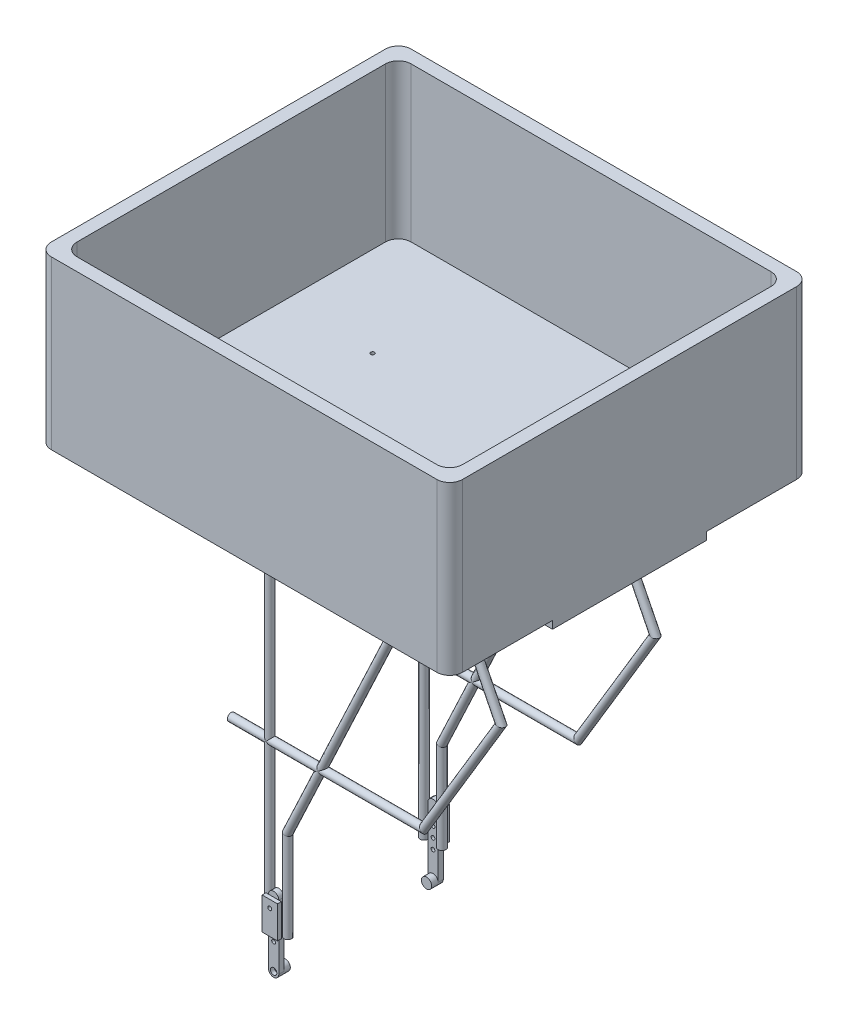
from build123d import *
from build123d.topology import SkipClean

# Parameters (mm, degrees)
SKETCH1_W            = 406.4
SKETCH1_H            = 355.6
BOSS_EXTRUDE1_DEPTH  = 165.1
FILLET1_R            = 12.7
FILLET2_R            = 12.7
FILLET3_R            = 12.7
FILLET4_R            = 12.7
SHELL1_START         = 12.7
SHELL1_OUTLINE_W     = 152.4
SHELL1_OUTLINE_H     = 330.2
SHELL1_DEPTH         = 381
FILLET5_R            = 12.7
FILLET6_R            = 12.7
FILLET7_R            = 12.7
FILLET8_R            = 12.7
SKETCH2_W            = 406.4
SKETCH2_H            = 152.4
BOSS_EXTRUDE2_DEPTH  = 7.62
BOSS_EXTRUDE3_START  = -60.96
BOSS_EXTRUDE3_DEPTH  = 3.81
BOSS_EXTRUDE4_START  = -57.15
BOSS_EXTRUDE4_DEPTH  = 3.81
SWEEP1_PROFILE_R     = 3.81
SWEEP2_PROFILE_R     = 3.81
SWEEP3_PROFILE_R     = 3.81
SWEEP4_PROFILE_R     = 3.81
SWEEP5_PROFILE_R     = 3.81
SWEEP6_PROFILE_R     = 3.81
BOSS_EXTRUDE5_DEPTH  = 5.08
BOSS_EXTRUDE6_DEPTH  = 5.08
SKETCH67_R           = 5.08
BOSS_EXTRUDE9_DEPTH  = 6.35
SKETCH68_R           = 5.08
BOSS_EXTRUDE10_DEPTH = 6.35
SKETCH69_R           = 3.175
CUT_EXTRUDE1_DEPTH   = 3.81
SKETCH70_R           = 3.175
CUT_EXTRUDE2_DEPTH   = 3.81
SKETCH71_R           = 1.905
CUT_EXTRUDE3_DEPTH   = 652.351540184
SKETCH64_W           = 15.24
SKETCH64_H           = 31.75
BOSS_EXTRUDE11_DEPTH = 3.81
SKETCH65_W           = 15.24
SKETCH65_H           = 31.75
BOSS_EXTRUDE12_DEPTH = 3.81
CUT_EXTRUDE4_START   = -33.02
SKETCH72_R           = 1.905
CUT_EXTRUDE4_DEPTH   = 685.371540184
SKETCH73_R           = 1.905
CUT_EXTRUDE5_DEPTH   = 630.194965809
CUT_EXTRUDE6_START   = 5.08
SKETCH74_R           = 1.905
CUT_EXTRUDE6_DEPTH   = 3.81
CUT_EXTRUDE7_START   = 1.27
SKETCH75_R           = 1.905
CUT_EXTRUDE7_DEPTH   = 3.81
SKETCH76_R           = 1.905
CUT_EXTRUDE8_DEPTH   = 691.628989328


# Read off the part's stored shape, not the designer's step: Shell1
with BuildPart() as part:
    # Sketch1 → Boss-Extrude1 (new body)
    with BuildSketch(Plane(origin=(0, 0, 0), x_dir=(1, 0, 0), z_dir=(0, 1, 0))):
        with Locations((203.2, -177.8)):
            Rectangle(SKETCH1_W, SKETCH1_H)
    extrude(amount=BOSS_EXTRUDE1_DEPTH)

    # Fillet1
    fillet1_edges = [part.edges().sort_by_distance(p)[0] for p in [
        (0, 82.55, 0),
    ]]
    fillet(fillet1_edges, radius=FILLET1_R)

    # Fillet2
    fillet2_edges = [part.edges().sort_by_distance(p)[0] for p in [
        (0, 82.55, 355.6),
    ]]
    fillet(fillet2_edges, radius=FILLET2_R)

    # Fillet3
    fillet3_edges = [part.edges().sort_by_distance(p)[0] for p in [
        (406.4, 82.55, 0),
    ]]
    fillet(fillet3_edges, radius=FILLET3_R)

    # Fillet4
    fillet4_edges = [part.edges().sort_by_distance(p)[0] for p in [
        (406.4, 82.55, 355.6),
    ]]
    fillet(fillet4_edges, radius=FILLET4_R)

    # Shell1 outline → Shell1 (cut)
    with BuildSketch(Plane.YZ.offset(SHELL1_START)):
        with Locations((88.9, 177.8)):
            Rectangle(SHELL1_OUTLINE_W, SHELL1_OUTLINE_H)
    extrude(amount=SHELL1_DEPTH, mode=Mode.SUBTRACT)

    # Fillet5
    fillet5_edges = [part.edges().sort_by_distance(p)[0] for p in [
        (12.7, 88.9, 12.7),
    ]]
    fillet(fillet5_edges, radius=FILLET5_R)

    # Fillet6
    fillet6_edges = [part.edges().sort_by_distance(p)[0] for p in [
        (12.7, 88.9, 342.9),
    ]]
    fillet(fillet6_edges, radius=FILLET6_R)

    # Fillet7
    fillet7_edges = [part.edges().sort_by_distance(p)[0] for p in [
        (393.7, 88.9, 12.7),
    ]]
    fillet(fillet7_edges, radius=FILLET7_R)

    # Fillet8
    fillet8_edges = [part.edges().sort_by_distance(p)[0] for p in [
        (393.7, 88.9, 342.9),
    ]]
    fillet(fillet8_edges, radius=FILLET8_R)

    # Sketch2 → Boss-Extrude2 (add)
    with BuildSketch(Plane.XZ):
        with Locations((203.2, 177.8)):
            Rectangle(SKETCH2_W, SKETCH2_H)
    extrude(amount=BOSS_EXTRUDE2_DEPTH)

    # Sketch3 → Boss-Extrude3 (add)
    with BuildSketch(Plane.XY.offset(254).offset(BOSS_EXTRUDE3_START)):
        with BuildLine():
            Line((27.692915238, -6.852801293), (-134.589820403, -129.141613998))
            ThreePointArc((-134.589820403, -129.141613998), (-139.925536935, -128.391727943), (-139.17565088, -123.056011411))
            Line((-139.17565088, -123.056011411), (23.107084762, -0.767198707))
            ThreePointArc((23.107084762, -0.767198707), (28.442801293, -1.517084762), (27.692915238, -6.852801293))
        make_face()
    extrude(amount=BOSS_EXTRUDE3_DEPTH)

    # Sketch4 → Boss-Extrude4 (add)
    with BuildSketch(Plane(origin=(0, 0, 101.6), x_dir=(-1, 0, 0), z_dir=(0, 0, -1)).offset(BOSS_EXTRUDE4_START)):
        with BuildLine():
            Line((134.589820403, -129.141613998), (-27.692915238, -6.852801293))
            ThreePointArc((-27.692915238, -6.852801293), (-28.442801293, -1.517084762), (-23.107084762, -0.767198707))
            Line((-23.107084762, -0.767198707), (139.17565088, -123.056011411))
            ThreePointArc((139.17565088, -123.056011411), (139.925536935, -128.391727943), (134.589820403, -129.141613998))
        make_face()
    extrude(amount=-BOSS_EXTRUDE4_DEPTH)

    # Sweep1: sweep along a path in Sketch5
    with BuildLine(Plane.XY.offset(254)) as sweep1_path:
        Line((127, 0), (127, -401.32))
    # Sweep1 profile (on start of the path) → Sweep1 (sweep)
    with BuildSketch(Plane(origin=(127, 0, 254), x_dir=(-1, 0, 0), z_dir=(0, -1, 0))):
        Circle(SWEEP1_PROFILE_R)
    sweep(path=sweep1_path.line)

    # Sweep2: sweep along a path in Sketch15
    with BuildLine(Plane.XY.offset(254)) as sweep2_path:
        Line((279.4, 0), (279.4, -25.4))
        Line((279.4, -25.4), (144.78, -312.42))
        Line((144.78, -312.42), (144.78, -401.32))
    # Sweep2 profile (on start of the path) → Sweep2 (sweep)
    with BuildSketch(Plane(origin=(279.4, 0, 254), x_dir=(-1, 0, 0), z_dir=(0, -1, 0))):
        Circle(SWEEP2_PROFILE_R)
    sweep(path=sweep2_path.line, transition=Transition.RIGHT)

    # Sweep3: sweep along a path in Sketch24
    with BuildLine(Plane(origin=(0, 0, 101.6), x_dir=(-1, 0, 0), z_dir=(0, 0, -1))) as sweep3_path:
        Line((-127, 0), (-127, -401.32))
    # Sweep3 profile (on start of the path) → Sweep3 (sweep)
    with BuildSketch(Plane(origin=(127, 0, 101.6), x_dir=(-1, 0, 0), z_dir=(0, -1, 0))):
        Circle(SWEEP3_PROFILE_R)
    sweep(path=sweep3_path.line)

    # Sweep4: sweep along a path in Sketch33
    with BuildLine(Plane(origin=(0, 0, 101.6), x_dir=(-1, 0, 0), z_dir=(0, 0, -1))) as sweep4_path:
        Line((-279.4, 0), (-279.4, -25.4))
        Line((-279.4, -25.4), (-144.78, -312.42))
        Line((-144.78, -312.42), (-144.78, -401.32))
    # Sweep4 profile (on start of the path) → Sweep4 (sweep)
    with BuildSketch(Plane(origin=(279.4, 0, 101.6), x_dir=(0, 0, -1), z_dir=(0, -1, 0))):
        Circle(SWEEP4_PROFILE_R)
    sweep(path=sweep4_path.line, transition=Transition.RIGHT)

    # Sweep5: sweep along a path in Sketch42
    with BuildLine(Plane(origin=(0, 0, 101.6), x_dir=(-1, 0, 0), z_dir=(0, 0, -1))) as sweep5_path:
        Line((-88.9, -38.1), (-317.5, -38.1))
        Line((-317.5, -38.1), (-355.6, -114.3))
        Line((-355.6, -114.3), (-279.4, -241.3))
        Line((-279.4, -241.3), (-88.9, -241.3))
    # Sweep5 profile (on start of the path) → Sweep5 (sweep)
    with BuildSketch(Plane(origin=(88.9, -38.1, 101.6), x_dir=(0, 1, 0), z_dir=(1, 0, 0))):
        Circle(SWEEP5_PROFILE_R)
    sweep(path=sweep5_path.line, transition=Transition.RIGHT)

    # Sweep6: sweep along a path in Sketch51
    with BuildLine(Plane.XY.offset(254)) as sweep6_path:
        Line((88.9, -38.1), (317.5, -38.1))
        Line((317.5, -38.1), (355.6, -114.3))
        Line((355.6, -114.3), (279.4, -241.3))
        Line((279.4, -241.3), (88.9, -241.3))
    # Sweep6 profile (on start of the path) → Sweep6 (sweep)
    with BuildSketch(Plane(origin=(88.9, -38.1, 254), x_dir=(0, 1, 0), z_dir=(1, 0, 0))):
        Circle(SWEEP6_PROFILE_R)
    sweep(path=sweep6_path.line, transition=Transition.RIGHT)

    # Sketch73 → Cut-Extrude5 (cut, through all)
    with BuildSketch(Plane.XY.offset(196.85)):
        with Locations(Location((-136.882735642, -126.098812704, 0), (0, 0, 180))):
            Circle(SKETCH73_R)
    extrude(amount=-CUT_EXTRUDE5_DEPTH, mode=Mode.SUBTRACT)

    # Sketch74 → Cut-Extrude6 (cut)
    with BuildSketch(Plane.XY.offset(254).offset(CUT_EXTRUDE6_START)):
        with Locations((127, -3.81)):
            Circle(SKETCH74_R)
        with Locations((279.4, -3.846627326)):
            Circle(SKETCH74_R)
    extrude(amount=-CUT_EXTRUDE6_DEPTH, mode=Mode.SUBTRACT)

    # Sketch75 → Cut-Extrude7 (cut)
    with BuildSketch(Plane(origin=(0, 0, 101.6), x_dir=(-1, 0, 0), z_dir=(0, 0, -1)).offset(CUT_EXTRUDE7_START)):
        with Locations(Location((-127, -3.81, 0), (0, 0, 180))):
            Circle(SKETCH75_R)
        with Locations((-279.4, -3.81)):
            Circle(SKETCH75_R)
    extrude(amount=CUT_EXTRUDE7_DEPTH, mode=Mode.SUBTRACT)

    # Sketch76 → Cut-Extrude8 (cut, through all)
    with BuildSketch(Plane.XZ.offset(7.62)):
        with Locations(Location((101.6, 228.6, 0), (0, 0, 270))):
            Circle(SKETCH76_R)
        with Locations(Location((101.6, 127, 0), (0, 0, 90))):
            Circle(SKETCH76_R)
        with Locations(Location((304.8, 228.6, 0), (0, 0, 90))):
            Circle(SKETCH76_R)
        with Locations(Location((304.8, 127, 0), (0, 0, 270))):
            Circle(SKETCH76_R)
    extrude(amount=-CUT_EXTRUDE8_DEPTH, mode=Mode.SUBTRACT)


with BuildPart() as body_2:
    # Sketch60 → Boss-Extrude5 (new body)
    with BuildSketch(Plane.XY.offset(254)):
        with BuildLine():
            Line((140.97, -369.57), (140.97, -433.07))
            ThreePointArc((140.97, -433.07), (135.89, -438.15), (130.81, -433.07))
            Line((130.81, -433.07), (130.81, -369.57))
            ThreePointArc((130.81, -369.57), (135.89, -364.49), (140.97, -369.57))
        make_face()
    extrude(amount=BOSS_EXTRUDE5_DEPTH)

    # Sketch67 → Boss-Extrude9 (add)
    with SkipClean():  # the faces are left unmerged after this step: merging them gives an invalid solid
        with BuildSketch(Plane(origin=(0, 0, 254), x_dir=(-1, 0, 0), z_dir=(0, 0, -1))):
            with Locations((-135.89, -433.07)):
                Circle(SKETCH67_R)
        extrude(amount=BOSS_EXTRUDE9_DEPTH)

    # Sketch69 → Cut-Extrude1 (cut)
    with SkipClean():  # the faces are left unmerged after this step: merging them gives an invalid solid
        with BuildSketch(Plane.XY.offset(259.08)):
            with Locations((135.89, -433.07)):
                Circle(SKETCH69_R)
        extrude(amount=-CUT_EXTRUDE1_DEPTH, mode=Mode.SUBTRACT)


with BuildPart() as body_3:
    # Sketch62 → Boss-Extrude6 (new body)
    with BuildSketch(Plane(origin=(0, 0, 101.6), x_dir=(-1, 0, 0), z_dir=(0, 0, -1))):
        with BuildLine():
            Line((-130.81, -369.57), (-130.81, -433.07))
            ThreePointArc((-130.81, -433.07), (-135.89, -438.15), (-140.97, -433.07))
            Line((-140.97, -433.07), (-140.97, -369.57))
            ThreePointArc((-140.97, -369.57), (-135.89, -364.49), (-130.81, -369.57))
        make_face()
    extrude(amount=BOSS_EXTRUDE6_DEPTH)

    # Sketch68 → Boss-Extrude10 (add)
    with SkipClean():  # the faces are left unmerged after this step: merging them gives an invalid solid
        with BuildSketch(Plane.XY.offset(101.6)):
            with Locations((135.89, -433.07)):
                Circle(SKETCH68_R)
        extrude(amount=BOSS_EXTRUDE10_DEPTH)

    # Sketch70 → Cut-Extrude2 (cut)
    with SkipClean():  # the faces are left unmerged after this step: merging them gives an invalid solid
        with BuildSketch(Plane(origin=(0, 0, 96.52), x_dir=(-1, 0, 0), z_dir=(0, 0, -1))):
            with Locations((-135.89, -433.07)):
                Circle(SKETCH70_R)
        extrude(amount=-CUT_EXTRUDE2_DEPTH, mode=Mode.SUBTRACT)


with BuildPart() as cut_extrude3_tool:
    # Sketch71 → Cut-Extrude3 (new, through all)
    with SkipClean():  # the faces are left unmerged after this step: merging them gives an invalid solid
        with BuildSketch(Plane(origin=(0, 0, 96.52), x_dir=(-1, 0, 0), z_dir=(0, 0, -1))):
            with Locations((-135.89, -407.67)):
                Circle(SKETCH71_R)
            with Locations((-135.89, -387.35)):
                Circle(SKETCH71_R)
            with Locations((-135.89, -397.51)):
                Circle(SKETCH71_R)
            with Locations((-135.89, -377.19)):
                Circle(SKETCH71_R)
        extrude(amount=-CUT_EXTRUDE3_DEPTH)


with BuildPart() as body_2_1:
    with SkipClean():  # the faces are left unmerged after this step: merging them gives an invalid solid
        add(body_2.part)

        # Cut-Extrude3: cut by cut_extrude3_tool
        add(cut_extrude3_tool.part, mode=Mode.SUBTRACT)

    # Sketch65 → Boss-Extrude12 (add)
    with SkipClean():  # the faces are left unmerged after this step: merging them gives an invalid solid
        with BuildSketch(Plane.XY.offset(259.08)):
            with Locations((135.89, -385.445)):
                Rectangle(SKETCH65_W, SKETCH65_H)
        extrude(amount=BOSS_EXTRUDE12_DEPTH)


with BuildPart() as body_3_1:
    with SkipClean():  # the faces are left unmerged after this step: merging them gives an invalid solid
        add(body_3.part)

        # Cut-Extrude3: cut by cut_extrude3_tool
        add(cut_extrude3_tool.part, mode=Mode.SUBTRACT)

    # Sketch64 → Boss-Extrude11 (add)
    with SkipClean():  # the faces are left unmerged after this step: merging them gives an invalid solid
        with BuildSketch(Plane(origin=(0, 0, 96.52), x_dir=(-1, 0, 0), z_dir=(0, 0, -1))):
            with Locations((-135.89, -385.445)):
                Rectangle(SKETCH64_W, SKETCH64_H)
        extrude(amount=BOSS_EXTRUDE11_DEPTH)


with BuildPart() as cut_extrude4_tool:
    # Sketch72 → Cut-Extrude4 (new, through all)
    with SkipClean():  # the faces are left unmerged after this step: merging them gives an invalid solid
        with BuildSketch(Plane(origin=(0, 0, 259.08), x_dir=(-1, 0, 0), z_dir=(0, 0, -1)).offset(CUT_EXTRUDE4_START)):
            with Locations((-135.89, -377.19)):
                Circle(SKETCH72_R)
        extrude(amount=CUT_EXTRUDE4_DEPTH)


with BuildPart() as body_2_2:
    with SkipClean():  # the faces are left unmerged after this step: merging them gives an invalid solid
        add(body_2_1.part)

        # Cut-Extrude4: cut by cut_extrude4_tool
        add(cut_extrude4_tool.part, mode=Mode.SUBTRACT)


with BuildPart() as body_3_2:
    with SkipClean():  # the faces are left unmerged after this step: merging them gives an invalid solid
        add(body_3_1.part)

        # Cut-Extrude4: cut by cut_extrude4_tool
        add(cut_extrude4_tool.part, mode=Mode.SUBTRACT)


solid = Compound([part.part, body_2_2.part, body_3_2.part])
